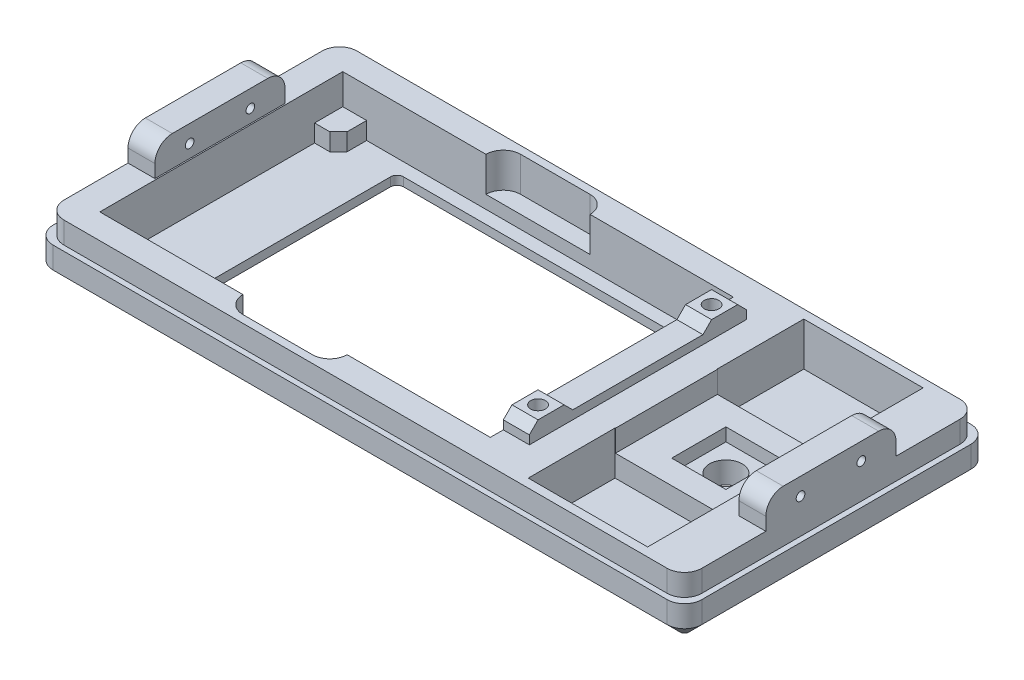
from build123d import *

# Parameters (mm, degrees)
SKETCH1_W           = 149.5
SKETCH1_H           = 70
BOSS_EXTRUDE1_DEPTH = 8
FILLET1_R           = 4
SKETCH6_W           = 147
SKETCH6_H           = 67.5
BOSS_EXTRUDE3_DEPTH = 5
FILLET2_R           = 4
SKETCH7_W           = 6.205469591
SKETCH7_H           = 30
BOSS_EXTRUDE4_DEPTH = 7
SKETCH8_R           = 1
CUT_EXTRUDE3_DEPTH  = 154.632882223
FILLET5_R           = 4
SKETCH9_W           = 90
SKETCH9_H           = 56
CUT_EXTRUDE4_DEPTH  = 7
SKETCH10_W          = 79
SKETCH10_H          = 56
CUT_EXTRUDE5_DEPTH  = 4
SKETCH11_W          = 66
SKETCH11_H          = 50
CUT_EXTRUDE6_DEPTH  = 85.478177656
SKETCH13_W          = 6
SKETCH13_H          = 50
BOSS_EXTRUDE5_DEPTH = 4
SKETCH14_R          = 1.692809378
CUT_EXTRUDE7_DEPTH  = 85.270768953
SKETCH15_W          = 6
SKETCH15_H          = 30
CUT_EXTRUDE8_DEPTH  = 2
CHAMFER2_SIZE       = 2
SKETCH16_R          = 3.75
CUT_EXTRUDE9_DEPTH  = 84.555744865
SKETCH17_W          = 12.5
SKETCH17_H          = 12.5
CUT_EXTRUDE10_DEPTH = 8
SKETCH20_W          = 24
SKETCH20_H          = 4
CUT_EXTRUDE12_DEPTH = 8
FILLET6_R           = 4
CHAMFER3_SIZE       = 2
SKETCH23_W          = 5.5
SKETCH23_H          = 43
CUT_EXTRUDE15_DEPTH = 4
FILLET7_R           = 1.5
CHAMFER6_SIZE       = 2
SKETCH26_W          = 27.5
SKETCH26_H          = 20
CUT_EXTRUDE16_DEPTH = 10
SKETCH27_W          = 27.410939183
SKETCH27_H          = 28.83766823
CUT_EXTRUDE17_DEPTH = 5
CHAMFER7_SIZE       = 3


with BuildPart() as part:
    # Sketch1 → Boss-Extrude1 (new body)
    with BuildSketch(Plane(origin=(0, 0, 0), x_dir=(1, 0, 0), z_dir=(0, 1, 0))):
        Rectangle(SKETCH1_W, SKETCH1_H)
    extrude(amount=BOSS_EXTRUDE1_DEPTH)

    # Fillet1
    fillet1_edges = [part.edges().sort_by_distance(p)[0] for p in [
        (74.75, 4, 35),
        (-74.75, 4, 35),
        (-74.75, 4, -35),
        (74.75, 4, -35),
    ]]
    fillet(fillet1_edges, radius=FILLET1_R)

    # Sketch6 → Boss-Extrude3 (add)
    with BuildSketch(Plane(origin=(0, 8, 0), x_dir=(1, 0, 0), z_dir=(0, 1, 0))):
        Rectangle(SKETCH6_W, SKETCH6_H)
    extrude(amount=BOSS_EXTRUDE3_DEPTH)

    # Fillet2
    fillet2_edges = [part.edges().sort_by_distance(p)[0] for p in [
        (73.5, 10.5, 33.75),
        (73.5, 10.5, -33.75),
        (-73.5, 10.5, -33.75),
        (-73.5, 10.5, 33.75),
    ]]
    fillet(fillet2_edges, radius=FILLET2_R)

    # Sketch7 → Boss-Extrude4 (add)
    with BuildSketch(Plane(origin=(0, 13, 0), x_dir=(1, 0, 0), z_dir=(0, 1, 0))):
        with Locations((-70.397265205, 0)):
            Rectangle(SKETCH7_W, SKETCH7_H)
        with Locations((70.397265205, 0)):
            Rectangle(SKETCH7_W, SKETCH7_H)
    extrude(amount=BOSS_EXTRUDE4_DEPTH)

    # Sketch8 → Cut-Extrude3 (cut, through all)
    with BuildSketch(Plane.ZY.offset(73.5)):
        with Locations((-7, 16)):
            Circle(SKETCH8_R)
        with Locations((7, 16)):
            Circle(SKETCH8_R)
    extrude(amount=-CUT_EXTRUDE3_DEPTH, mode=Mode.SUBTRACT)

    # Fillet5
    fillet5_edges = [part.edges().sort_by_distance(p)[0] for p in [
        (-70.397265204, 20, 15),
        (-70.397265204, 20, -15),
        (70.397265204, 20, -15),
        (70.397265204, 20, 15),
    ]]
    fillet(fillet5_edges, radius=FILLET5_R)

    # Sketch9 → Cut-Extrude4 (cut)
    with BuildSketch(Plane(origin=(0, 13, 0), x_dir=(1, 0, 0), z_dir=(0, 1, 0))):
        with Locations((-22, 0)):
            Rectangle(SKETCH9_W, SKETCH9_H)
    extrude(amount=-CUT_EXTRUDE4_DEPTH, mode=Mode.SUBTRACT)

    # Sketch10 → Cut-Extrude5 (cut)
    with BuildSketch(Plane(origin=(0, 6, 0), x_dir=(1, 0, 0), z_dir=(0, 1, 0))):
        with Locations((-22, 0)):
            Rectangle(SKETCH10_W, SKETCH10_H)
    extrude(amount=-CUT_EXTRUDE5_DEPTH, mode=Mode.SUBTRACT)

    # Sketch11 → Cut-Extrude6 (cut, through all)
    with BuildSketch(Plane(origin=(0, 2, 0), x_dir=(1, 0, 0), z_dir=(0, 1, 0))):
        with Locations((-18.5, 0)):
            Rectangle(SKETCH11_W, SKETCH11_H)
    extrude(amount=-CUT_EXTRUDE6_DEPTH, mode=Mode.SUBTRACT)

    # Sketch13 → Boss-Extrude5 (add)
    with BuildSketch(Plane(origin=(0, 13, 0), x_dir=(1, 0, 0), z_dir=(0, 1, 0))):
        with Locations((26, 0)):
            Rectangle(SKETCH13_W, SKETCH13_H)
    extrude(amount=BOSS_EXTRUDE5_DEPTH)

    # Sketch14 → Cut-Extrude7 (cut, through all)
    with BuildSketch(Plane(origin=(0, 17, 0), x_dir=(1, 0, 0), z_dir=(0, 1, 0))):
        with Locations(Location((26, 20, 0), (0, 0, 270))):
            Circle(SKETCH14_R)
        with Locations(Location((26, -20, 0), (0, 0, 90))):
            Circle(SKETCH14_R)
    extrude(amount=-CUT_EXTRUDE7_DEPTH, mode=Mode.SUBTRACT)

    # Sketch15 → Cut-Extrude8 (cut)
    with BuildSketch(Plane(origin=(0, 17, 0), x_dir=(1, 0, 0), z_dir=(0, 1, 0))):
        with Locations((26, 0)):
            Rectangle(SKETCH15_W, SKETCH15_H)
    extrude(amount=-CUT_EXTRUDE8_DEPTH, mode=Mode.SUBTRACT)

    # Chamfer2
    chamfer2_edges = [part.edges().sort_by_distance(p)[0] for p in [
        (26, 0, -21.692809378),
        (26, 0, 21.692809378),
    ]]
    chamfer(chamfer2_edges, length=CHAMFER2_SIZE)

    # Sketch16 → Cut-Extrude9 (cut, through all)
    with BuildSketch(Plane(origin=(0, 13, 0), x_dir=(1, 0, 0), z_dir=(0, 1, 0))):
        with Locations(Location((49.294530409, 0, 0), (0, 0, 270))):
            Circle(SKETCH16_R)
    extrude(amount=-CUT_EXTRUDE9_DEPTH, mode=Mode.SUBTRACT)

    # Sketch17 → Cut-Extrude10 (cut)
    with BuildSketch(Plane(origin=(0, 13, 0), x_dir=(1, 0, 0), z_dir=(0, 1, 0))):
        with Locations((49.294530409, 0)):
            Rectangle(SKETCH17_W, SKETCH17_H)
    extrude(amount=-CUT_EXTRUDE10_DEPTH, mode=Mode.SUBTRACT)

    # Sketch20 → Cut-Extrude12 (cut)
    with BuildSketch(Plane(origin=(0, 13, 0), x_dir=(1, 0, 0), z_dir=(0, 1, 0))):
        with Locations((-22, 30)):
            Rectangle(SKETCH20_W, SKETCH20_H)
        with Locations((-22, -30)):
            Rectangle(SKETCH20_W, SKETCH20_H)
    extrude(amount=-CUT_EXTRUDE12_DEPTH, mode=Mode.SUBTRACT)

    # Fillet6
    fillet6_edges = [part.edges().sort_by_distance(p)[0] for p in [
        (-34, 9, 32),
        (-10, 9, 32),
        (-10, 9, -32),
        (-34, 9, -32),
    ]]
    fillet(fillet6_edges, radius=FILLET6_R - 0.0001)  # a hair under: the kernel refuses the full size

    # Chamfer3
    chamfer3_edges = [part.edges().sort_by_distance(p)[0] for p in [
        (26, 17, 15),
        (26, 17, -15),
        (26, 17, -25),
        (26, 17, 25),
    ]]
    chamfer(chamfer3_edges, length=CHAMFER3_SIZE - 0.0001)  # a hair under: the kernel refuses the full size

    # Sketch23 → Cut-Extrude15 (cut)
    with BuildSketch(Plane(origin=(0, 6, 0), x_dir=(1, 0, 0), z_dir=(0, 1, 0))):
        with Locations((-64.25, 0)):
            Rectangle(SKETCH23_W, SKETCH23_H)
        with Locations((20.25, 0)):
            Rectangle(SKETCH23_W, SKETCH23_H)
    extrude(amount=-CUT_EXTRUDE15_DEPTH, mode=Mode.SUBTRACT)

    # Fillet7
    fillet7_edges = [part.edges().sort_by_distance(p)[0] for p in [
        (14.5, 1, -25),
        (14.5, 1, 25),
        (-51.5, 1, 25),
        (-51.5, 1, -25),
    ]]
    fillet(fillet7_edges, radius=FILLET7_R)

    # Chamfer6
    chamfer6_edges = [part.edges().sort_by_distance(p)[0] for p in [
        (-61.5, 4, 21.5),
        (-61.5, 4, -21.5),
        (17.5, 4, 21.5),
        (17.5, 4, -21.5),
    ]]
    chamfer(chamfer6_edges, length=CHAMFER6_SIZE)

    # Sketch26 → Cut-Extrude16 (cut)
    with BuildSketch(Plane(origin=(0, 13, 0), x_dir=(1, 0, 0), z_dir=(0, 1, 0))):
        with Locations((49.25, -21.75)):
            Rectangle(SKETCH26_W, SKETCH26_H)
        with Locations((49.25, 21.75)):
            Rectangle(SKETCH26_W, SKETCH26_H)
    extrude(amount=-CUT_EXTRUDE16_DEPTH, mode=Mode.SUBTRACT)

    # Sketch27 → Cut-Extrude17 (cut)
    with BuildSketch(Plane(origin=(0, 13, 0), x_dir=(1, 0, 0), z_dir=(0, 1, 0))):
        with Locations((49.294530409, 0)):
            Rectangle(SKETCH27_W, SKETCH27_H)
    extrude(amount=-CUT_EXTRUDE17_DEPTH, mode=Mode.SUBTRACT)

    # Chamfer7
    chamfer7_edges = [part.edges().sort_by_distance(p)[0] for p in [
        (-74.75, 0, 0),
        (74.75, 0, 0),
        (0, 0, 35),
        (0, 0, -35),
        (73.578427125, 0, 33.828427125),
        (73.578427125, 0, -33.828427125),
        (-73.578427125, 0, 33.828427125),
        (-73.578427125, 0, -33.828427125),
    ]]
    chamfer(chamfer7_edges, length=CHAMFER7_SIZE)


solid = part.part
